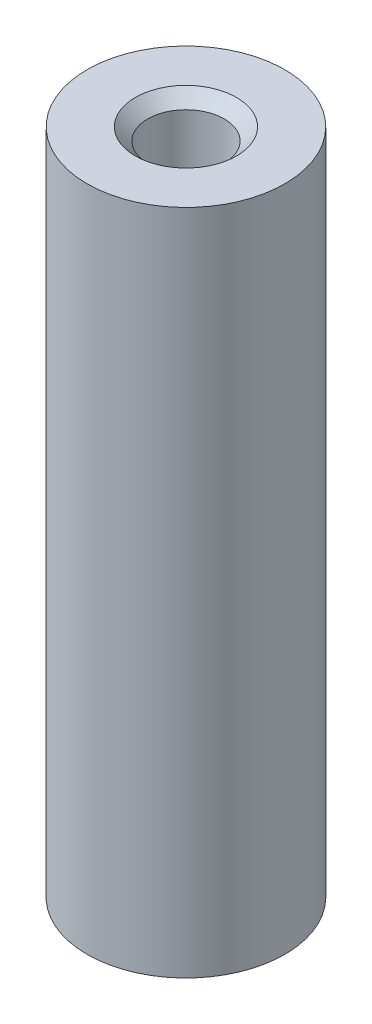
from build123d import *

# Parameters (mm, degrees)
SKIZZE1_R                        = 4
AUFSATZ_LINEAR_AUSTRAGEN1_DEPTH  = 27
F_3_1_3_1_DURCHMESSER_BOHRUNG1_D = 3.1
FASE1_SIZE                       = 0.5


with BuildPart() as part:
    # Skizze1 → Aufsatz-Linear austragen1 (new body)
    with BuildSketch(Plane(origin=(0, 0, 0), x_dir=(1, 0, 0), z_dir=(0, 1, 0))):
        Circle(SKIZZE1_R)
    extrude(amount=AUFSATZ_LINEAR_AUSTRAGEN1_DEPTH)

    # Ø3.1 (3.1) Durchmesser Bohrung1 (through all)
    with Locations(Plane(origin=(0, 27, 0), x_dir=(1, 0, 0), z_dir=(0, 1, 0))):
        with Locations((0, 0)):
            Hole(F_3_1_3_1_DURCHMESSER_BOHRUNG1_D / 2)

    # Fase1
    fase1_edges = [part.edges().sort_by_distance(p)[0] for p in [
        (1.55, 0, 0),
        (1.55, 27, 0),
    ]]
    chamfer(fase1_edges, length=FASE1_SIZE)


solid = part.part
